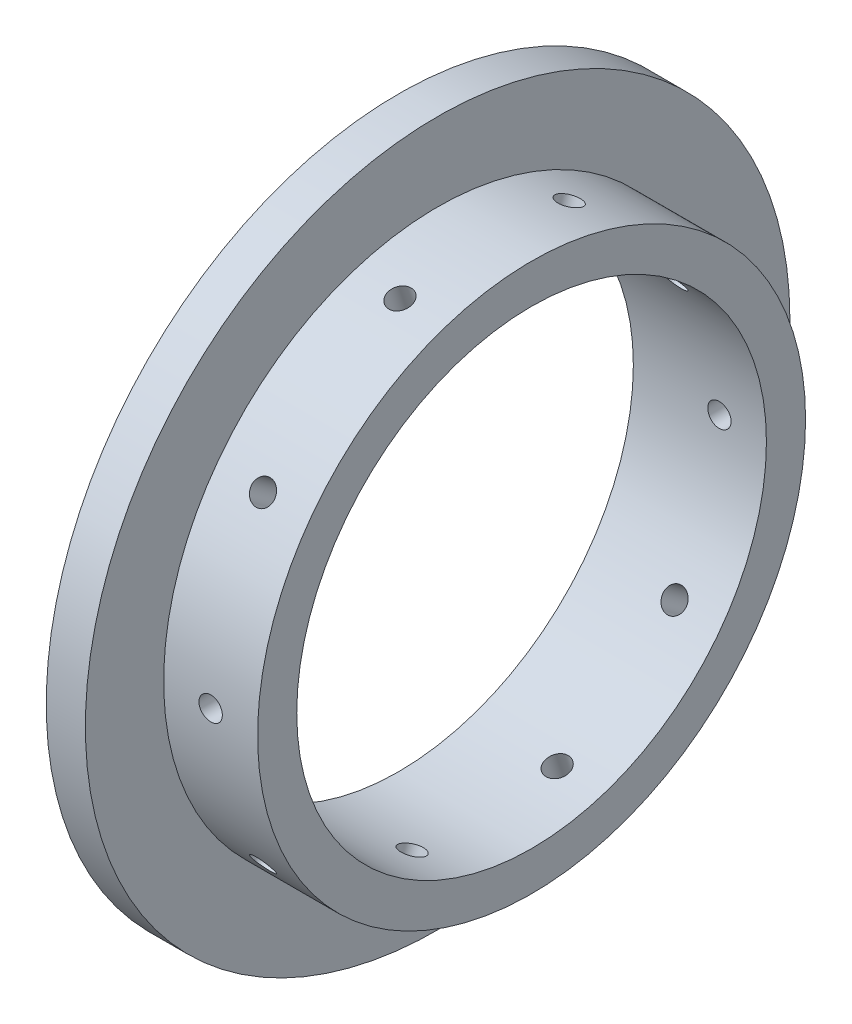
from build123d import *

# Parameters (mm, degrees)
SKETCH1_R           = 57.15
SKETCH1_R_2         = 38.1
BOSS_EXTRUDE1_DEPTH = 6.35
SKETCH2_R           = 44.45
SKETCH2_R_2         = 38.1
BOSS_EXTRUDE2_DEPTH = 15.24
SKETCH4_R           = 1.89865
CUT_EXTRUDE1_DEPTH  = 7.62
CIRPATTERN1_COUNT   = 10


with BuildPart() as part:
    # Sketch1 → Boss-Extrude1 (new body)
    with BuildSketch(Plane(origin=(0, 0, 0), x_dir=(0, 0, -1), z_dir=(1, 0, 0))):
        Circle(SKETCH1_R)
        Circle(SKETCH1_R_2, mode=Mode.SUBTRACT)
    extrude(amount=BOSS_EXTRUDE1_DEPTH)

    # Sketch2 → Boss-Extrude2 (add)
    with BuildSketch(Plane(origin=(6.35, 0, 0), x_dir=(0, 0, -1), z_dir=(1, 0, 0))):
        Circle(SKETCH2_R)
        Circle(SKETCH2_R_2, mode=Mode.SUBTRACT)
    extrude(amount=BOSS_EXTRUDE2_DEPTH)

    # Sketch4 → Cut-Extrude1 (cut)
    with BuildSketch(Plane(origin=(0, 0, -44.45), x_dir=(-1, 0, 0), z_dir=(0, 0, -1))):
        with Locations((-13.97, 0)):
            Circle(SKETCH4_R)
    cut_extrude1 = extrude(amount=-CUT_EXTRUDE1_DEPTH, mode=Mode.SUBTRACT)

    # CirPattern1: Cut-Extrude1 ×10 about axis
    cirpattern1_axis = Axis((0, 0, 0), (1, 0, 0))
    for i in range(1, CIRPATTERN1_COUNT):
        add(cut_extrude1.rotate(cirpattern1_axis, i * 360 / CIRPATTERN1_COUNT), mode=Mode.SUBTRACT)


solid = part.part
